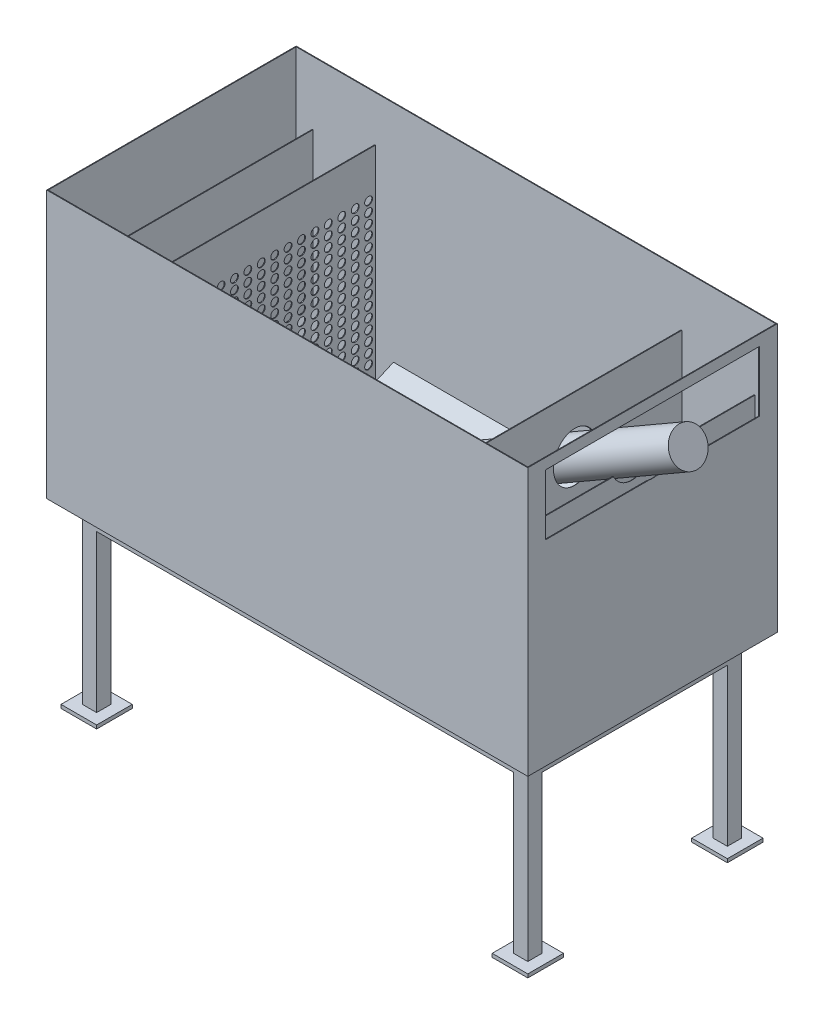
from build123d import *

# Parameters (mm, degrees)
MASTER_FOOTPRINT_W                  = 1350
MASTER_FOOTPRINT_H                  = 700
BATH_BASE_PLATE_DEPTH               = 750
BATH_SHELL_2MM_T                    = -2
SKETCH_1_R                          = 50
INLET_D100_OPENING_DEPTH            = 10
INLET_IMPACT_BAFFLE_START           = 125
SKETCH_2_W                          = 540
SKETCH_2_H                          = 430
INLET_IMPACT_BAFFLE_DEPTH           = 2
DISTRIBUTOR_D22_START               = 250
SKETCH_3_W                          = 640
SKETCH_3_H                          = 648
SKETCH_3_R                          = 11
DISTRIBUTOR_D22_DEPTH               = 2
OUTLET_SUBMERGED_BAFFLE_START       = 1130
SKETCH_4_W                          = 600
SKETCH_4_H                          = 330
OUTLET_SUBMERGED_BAFFLE_DEPTH       = 2
OVERFLOW_WEIR_Z550_START            = 1290
SKETCH_5_W                          = 690
SKETCH_5_H                          = 548
OVERFLOW_WEIR_Z550_DEPTH            = 2
OUTLET_WEIR_SLOT_W600_START         = 1345
SKETCH_6_W                          = 600
SKETCH_6_H                          = 170
OUTLET_WEIR_SLOT_W600_DEPTH         = 10
SLOPED_SEDIMENT_FLOOR_START         = 275
SLOPED_SEDIMENT_FLOOR_DEPTH         = 825
SKETCH_8_W                          = 40
SKETCH_8_H                          = 40
FRAME_LEGS_40X40_H500_DEPTH         = 500
FRAME_LONGITUDINAL_RAILS_START      = -20
SKETCH_9_W                          = 1250
SKETCH_9_H                          = 40
FRAME_LONGITUDINAL_RAILS_DEPTH      = 40
FRAME_TRANSVERSE_RAILS_START        = -20
SKETCH_10_W                         = 40
SKETCH_10_H                         = 520
FRAME_TRANSVERSE_RAILS_DEPTH        = 40
FRAME_FOOT_PADS_100X100_START       = -500
SKETCH_11_W                         = 100
SKETCH_11_H                         = 100
FRAME_FOOT_PADS_100X100_DEPTH       = 10
SEALED_SCREW_PASSAGE_D120_PROFILE_R = 60
SCREW_OUTER_ENVELOPE_D100_PROFILE_R = 50


with BuildPart() as part:
    # MASTER_FOOTPRINT → BATH_BASE_PLATE (new body)
    with BuildSketch(Plane(origin=(0, 0, 0), x_dir=(1, 0, 0), z_dir=(0, 1, 0))):
        with Locations((675, 350)):
            Rectangle(MASTER_FOOTPRINT_W, MASTER_FOOTPRINT_H)
    extrude(amount=BATH_BASE_PLATE_DEPTH)

    # BATH_SHELL_2MM
    bath_shell_2mm_openings = [part.faces().sort_by_distance(p)[0] for p in [
        (675, 750, -350),
    ]]
    offset(amount=BATH_SHELL_2MM_T, openings=bath_shell_2mm_openings, kind=Kind.INTERSECTION)

    # Эскиз1 → INLET_D100_OPENING (cut)
    with BuildSketch(Plane(origin=(0, 0, 0), x_dir=(0, 0, -1), z_dir=(1, 0, 0))):
        with Locations((350, 420)):
            Circle(SKETCH_1_R)
    extrude(amount=INLET_D100_OPENING_DEPTH, mode=Mode.SUBTRACT)

    # Эскиз6 → OUTLET_WEIR_SLOT_W600 (cut)
    with BuildSketch(Plane(origin=(0, 0, 0), x_dir=(0, 0, -1), z_dir=(1, 0, 0)).offset(OUTLET_WEIR_SLOT_W600_START)):
        with Locations((350, 635)):
            Rectangle(SKETCH_6_W, SKETCH_6_H)
    extrude(amount=OUTLET_WEIR_SLOT_W600_DEPTH, mode=Mode.SUBTRACT)

    # Эскиз7 → SLOPED_SEDIMENT_FLOOR (add)
    with BuildSketch(Plane(origin=(0, 0, 0), x_dir=(0, 0, -1), z_dir=(1, 0, 0)).offset(SLOPED_SEDIMENT_FLOOR_START)):
        Polygon((2, -1), (2, 120), (280, -1), align=None)
        Polygon((698, -1), (698, 120), (420, -1), align=None)
    extrude(amount=SLOPED_SEDIMENT_FLOOR_DEPTH)

    # Эскиз8 → FRAME_LEGS_40X40_H500 (add)
    with BuildSketch(Plane(origin=(0, 0, 0), x_dir=(1, 0, 0), z_dir=(0, 1, 0))):
        with Locations((70, 70)):
            Rectangle(SKETCH_8_W, SKETCH_8_H)
        with Locations((70, 630)):
            Rectangle(SKETCH_8_W, SKETCH_8_H)
        with Locations((1280, 70)):
            Rectangle(SKETCH_8_W, SKETCH_8_H)
        with Locations((1280, 630)):
            Rectangle(SKETCH_8_W, SKETCH_8_H)
    extrude(amount=-FRAME_LEGS_40X40_H500_DEPTH)

    # Эскиз9 → FRAME_LONGITUDINAL_RAILS (add)
    with BuildSketch(Plane(origin=(0, 0, 0), x_dir=(1, 0, 0), z_dir=(0, 1, 0)).offset(FRAME_LONGITUDINAL_RAILS_START)):
        with Locations((675, 70)):
            Rectangle(SKETCH_9_W, SKETCH_9_H)
        with Locations((675, 630)):
            Rectangle(SKETCH_9_W, SKETCH_9_H)
    extrude(amount=-FRAME_LONGITUDINAL_RAILS_DEPTH)

    # Эскиз10 → FRAME_TRANSVERSE_RAILS (add)
    with BuildSketch(Plane(origin=(0, 0, 0), x_dir=(1, 0, 0), z_dir=(0, 1, 0)).offset(FRAME_TRANSVERSE_RAILS_START)):
        with Locations((70, 350)):
            Rectangle(SKETCH_10_W, SKETCH_10_H)
        with Locations((1280, 350)):
            Rectangle(SKETCH_10_W, SKETCH_10_H)
    extrude(amount=-FRAME_TRANSVERSE_RAILS_DEPTH)

    # Эскиз11 → FRAME_FOOT_PADS_100X100 (add)
    with BuildSketch(Plane(origin=(0, 0, 0), x_dir=(1, 0, 0), z_dir=(0, 1, 0)).offset(FRAME_FOOT_PADS_100X100_START)):
        with Locations((70, 70)):
            Rectangle(SKETCH_11_W, SKETCH_11_H)
        with Locations((70, 630)):
            Rectangle(SKETCH_11_W, SKETCH_11_H)
        with Locations((1280, 70)):
            Rectangle(SKETCH_11_W, SKETCH_11_H)
        with Locations((1280, 630)):
            Rectangle(SKETCH_11_W, SKETCH_11_H)
    extrude(amount=-FRAME_FOOT_PADS_100X100_DEPTH)


with BuildPart() as body_2:
    # Эскиз2 → INLET_IMPACT_BAFFLE (new body)
    with BuildSketch(Plane(origin=(0, 0, 0), x_dir=(0, 0, -1), z_dir=(1, 0, 0)).offset(INLET_IMPACT_BAFFLE_START)):
        with Locations((350, 435)):
            Rectangle(SKETCH_2_W, SKETCH_2_H)
    extrude(amount=INLET_IMPACT_BAFFLE_DEPTH)


with BuildPart() as body_3:
    # Эскиз3 → DISTRIBUTOR_D22 (new body)
    with BuildSketch(Plane(origin=(0, 0, 0), x_dir=(0, 0, -1), z_dir=(1, 0, 0)).offset(DISTRIBUTOR_D22_START)):
        with Locations((350, 326)):
            Rectangle(SKETCH_3_W, SKETCH_3_H)
        with Locations((48.823529412, 125)):
            Circle(SKETCH_3_R, mode=Mode.SUBTRACT)
        with Locations((48.823529412, 153.5)):
            Circle(SKETCH_3_R, mode=Mode.SUBTRACT)
        with Locations((48.823529412, 182)):
            Circle(SKETCH_3_R, mode=Mode.SUBTRACT)
        with Locations((48.823529412, 210.5)):
            Circle(SKETCH_3_R, mode=Mode.SUBTRACT)
        with Locations((48.823529412, 239)):
            Circle(SKETCH_3_R, mode=Mode.SUBTRACT)
        with Locations((48.823529412, 267.5)):
            Circle(SKETCH_3_R, mode=Mode.SUBTRACT)
        with Locations((48.823529412, 296)):
            Circle(SKETCH_3_R, mode=Mode.SUBTRACT)
        with Locations((48.823529412, 324.5)):
            Circle(SKETCH_3_R, mode=Mode.SUBTRACT)
        with Locations((48.823529412, 353)):
            Circle(SKETCH_3_R, mode=Mode.SUBTRACT)
        with Locations((48.823529412, 381.5)):
            Circle(SKETCH_3_R, mode=Mode.SUBTRACT)
        with Locations((48.823529412, 410)):
            Circle(SKETCH_3_R, mode=Mode.SUBTRACT)
        with Locations((48.823529412, 438.5)):
            Circle(SKETCH_3_R, mode=Mode.SUBTRACT)
        with Locations((48.823529412, 467)):
            Circle(SKETCH_3_R, mode=Mode.SUBTRACT)
        with Locations((48.823529412, 495.5)):
            Circle(SKETCH_3_R, mode=Mode.SUBTRACT)
        with Locations((48.823529412, 524)):
            Circle(SKETCH_3_R, mode=Mode.SUBTRACT)
        with Locations((86.470588235, 125)):
            Circle(SKETCH_3_R, mode=Mode.SUBTRACT)
        with Locations((86.470588235, 153.5)):
            Circle(SKETCH_3_R, mode=Mode.SUBTRACT)
        with Locations((86.470588235, 182)):
            Circle(SKETCH_3_R, mode=Mode.SUBTRACT)
        with Locations((86.470588235, 210.5)):
            Circle(SKETCH_3_R, mode=Mode.SUBTRACT)
        with Locations((86.470588235, 239)):
            Circle(SKETCH_3_R, mode=Mode.SUBTRACT)
        with Locations((86.470588235, 267.5)):
            Circle(SKETCH_3_R, mode=Mode.SUBTRACT)
        with Locations((86.470588235, 296)):
            Circle(SKETCH_3_R, mode=Mode.SUBTRACT)
        with Locations((86.470588235, 324.5)):
            Circle(SKETCH_3_R, mode=Mode.SUBTRACT)
        with Locations((86.470588235, 353)):
            Circle(SKETCH_3_R, mode=Mode.SUBTRACT)
        with Locations((86.470588235, 381.5)):
            Circle(SKETCH_3_R, mode=Mode.SUBTRACT)
        with Locations((86.470588235, 410)):
            Circle(SKETCH_3_R, mode=Mode.SUBTRACT)
        with Locations((86.470588235, 438.5)):
            Circle(SKETCH_3_R, mode=Mode.SUBTRACT)
        with Locations((86.470588235, 467)):
            Circle(SKETCH_3_R, mode=Mode.SUBTRACT)
        with Locations((86.470588235, 495.5)):
            Circle(SKETCH_3_R, mode=Mode.SUBTRACT)
        with Locations((86.470588235, 524)):
            Circle(SKETCH_3_R, mode=Mode.SUBTRACT)
        with Locations((124.117647059, 125)):
            Circle(SKETCH_3_R, mode=Mode.SUBTRACT)
        with Locations((124.117647059, 153.5)):
            Circle(SKETCH_3_R, mode=Mode.SUBTRACT)
        with Locations((124.117647059, 182)):
            Circle(SKETCH_3_R, mode=Mode.SUBTRACT)
        with Locations((124.117647059, 210.5)):
            Circle(SKETCH_3_R, mode=Mode.SUBTRACT)
        with Locations((124.117647059, 239)):
            Circle(SKETCH_3_R, mode=Mode.SUBTRACT)
        with Locations((124.117647059, 267.5)):
            Circle(SKETCH_3_R, mode=Mode.SUBTRACT)
        with Locations((124.117647059, 296)):
            Circle(SKETCH_3_R, mode=Mode.SUBTRACT)
        with Locations((124.117647059, 324.5)):
            Circle(SKETCH_3_R, mode=Mode.SUBTRACT)
        with Locations((124.117647059, 353)):
            Circle(SKETCH_3_R, mode=Mode.SUBTRACT)
        with Locations((124.117647059, 381.5)):
            Circle(SKETCH_3_R, mode=Mode.SUBTRACT)
        with Locations((124.117647059, 410)):
            Circle(SKETCH_3_R, mode=Mode.SUBTRACT)
        with Locations((124.117647059, 438.5)):
            Circle(SKETCH_3_R, mode=Mode.SUBTRACT)
        with Locations((124.117647059, 467)):
            Circle(SKETCH_3_R, mode=Mode.SUBTRACT)
        with Locations((124.117647059, 495.5)):
            Circle(SKETCH_3_R, mode=Mode.SUBTRACT)
        with Locations((124.117647059, 524)):
            Circle(SKETCH_3_R, mode=Mode.SUBTRACT)
        with Locations((161.764705882, 125)):
            Circle(SKETCH_3_R, mode=Mode.SUBTRACT)
        with Locations((161.764705882, 153.5)):
            Circle(SKETCH_3_R, mode=Mode.SUBTRACT)
        with Locations((161.764705882, 182)):
            Circle(SKETCH_3_R, mode=Mode.SUBTRACT)
        with Locations((161.764705882, 210.5)):
            Circle(SKETCH_3_R, mode=Mode.SUBTRACT)
        with Locations((161.764705882, 239)):
            Circle(SKETCH_3_R, mode=Mode.SUBTRACT)
        with Locations((161.764705882, 267.5)):
            Circle(SKETCH_3_R, mode=Mode.SUBTRACT)
        with Locations((161.764705882, 296)):
            Circle(SKETCH_3_R, mode=Mode.SUBTRACT)
        with Locations((161.764705882, 324.5)):
            Circle(SKETCH_3_R, mode=Mode.SUBTRACT)
        with Locations((161.764705882, 353)):
            Circle(SKETCH_3_R, mode=Mode.SUBTRACT)
        with Locations((161.764705882, 381.5)):
            Circle(SKETCH_3_R, mode=Mode.SUBTRACT)
        with Locations((161.764705882, 410)):
            Circle(SKETCH_3_R, mode=Mode.SUBTRACT)
        with Locations((161.764705882, 438.5)):
            Circle(SKETCH_3_R, mode=Mode.SUBTRACT)
        with Locations((161.764705882, 467)):
            Circle(SKETCH_3_R, mode=Mode.SUBTRACT)
        with Locations((161.764705882, 495.5)):
            Circle(SKETCH_3_R, mode=Mode.SUBTRACT)
        with Locations((161.764705882, 524)):
            Circle(SKETCH_3_R, mode=Mode.SUBTRACT)
        with Locations((199.411764706, 125)):
            Circle(SKETCH_3_R, mode=Mode.SUBTRACT)
        with Locations((199.411764706, 153.5)):
            Circle(SKETCH_3_R, mode=Mode.SUBTRACT)
        with Locations((199.411764706, 182)):
            Circle(SKETCH_3_R, mode=Mode.SUBTRACT)
        with Locations((199.411764706, 210.5)):
            Circle(SKETCH_3_R, mode=Mode.SUBTRACT)
        with Locations((199.411764706, 239)):
            Circle(SKETCH_3_R, mode=Mode.SUBTRACT)
        with Locations((199.411764706, 267.5)):
            Circle(SKETCH_3_R, mode=Mode.SUBTRACT)
        with Locations((199.411764706, 296)):
            Circle(SKETCH_3_R, mode=Mode.SUBTRACT)
        with Locations((199.411764706, 324.5)):
            Circle(SKETCH_3_R, mode=Mode.SUBTRACT)
        with Locations((199.411764706, 353)):
            Circle(SKETCH_3_R, mode=Mode.SUBTRACT)
        with Locations((199.411764706, 381.5)):
            Circle(SKETCH_3_R, mode=Mode.SUBTRACT)
        with Locations((199.411764706, 410)):
            Circle(SKETCH_3_R, mode=Mode.SUBTRACT)
        with Locations((199.411764706, 438.5)):
            Circle(SKETCH_3_R, mode=Mode.SUBTRACT)
        with Locations((199.411764706, 467)):
            Circle(SKETCH_3_R, mode=Mode.SUBTRACT)
        with Locations((199.411764706, 495.5)):
            Circle(SKETCH_3_R, mode=Mode.SUBTRACT)
        with Locations((199.411764706, 524)):
            Circle(SKETCH_3_R, mode=Mode.SUBTRACT)
        with Locations((237.058823529, 125)):
            Circle(SKETCH_3_R, mode=Mode.SUBTRACT)
        with Locations((237.058823529, 153.5)):
            Circle(SKETCH_3_R, mode=Mode.SUBTRACT)
        with Locations((237.058823529, 182)):
            Circle(SKETCH_3_R, mode=Mode.SUBTRACT)
        with Locations((237.058823529, 210.5)):
            Circle(SKETCH_3_R, mode=Mode.SUBTRACT)
        with Locations((237.058823529, 239)):
            Circle(SKETCH_3_R, mode=Mode.SUBTRACT)
        with Locations((237.058823529, 267.5)):
            Circle(SKETCH_3_R, mode=Mode.SUBTRACT)
        with Locations((237.058823529, 296)):
            Circle(SKETCH_3_R, mode=Mode.SUBTRACT)
        with Locations((237.058823529, 324.5)):
            Circle(SKETCH_3_R, mode=Mode.SUBTRACT)
        with Locations((237.058823529, 353)):
            Circle(SKETCH_3_R, mode=Mode.SUBTRACT)
        with Locations((237.058823529, 381.5)):
            Circle(SKETCH_3_R, mode=Mode.SUBTRACT)
        with Locations((237.058823529, 410)):
            Circle(SKETCH_3_R, mode=Mode.SUBTRACT)
        with Locations((237.058823529, 438.5)):
            Circle(SKETCH_3_R, mode=Mode.SUBTRACT)
        with Locations((237.058823529, 467)):
            Circle(SKETCH_3_R, mode=Mode.SUBTRACT)
        with Locations((237.058823529, 495.5)):
            Circle(SKETCH_3_R, mode=Mode.SUBTRACT)
        with Locations((237.058823529, 524)):
            Circle(SKETCH_3_R, mode=Mode.SUBTRACT)
        with Locations((274.705882353, 125)):
            Circle(SKETCH_3_R, mode=Mode.SUBTRACT)
        with Locations((274.705882353, 153.5)):
            Circle(SKETCH_3_R, mode=Mode.SUBTRACT)
        with Locations((274.705882353, 182)):
            Circle(SKETCH_3_R, mode=Mode.SUBTRACT)
        with Locations((274.705882353, 210.5)):
            Circle(SKETCH_3_R, mode=Mode.SUBTRACT)
        with Locations((274.705882353, 239)):
            Circle(SKETCH_3_R, mode=Mode.SUBTRACT)
        with Locations((274.705882353, 267.5)):
            Circle(SKETCH_3_R, mode=Mode.SUBTRACT)
        with Locations((274.705882353, 296)):
            Circle(SKETCH_3_R, mode=Mode.SUBTRACT)
        with Locations((274.705882353, 324.5)):
            Circle(SKETCH_3_R, mode=Mode.SUBTRACT)
        with Locations((274.705882353, 353)):
            Circle(SKETCH_3_R, mode=Mode.SUBTRACT)
        with Locations((274.705882353, 381.5)):
            Circle(SKETCH_3_R, mode=Mode.SUBTRACT)
        with Locations((274.705882353, 410)):
            Circle(SKETCH_3_R, mode=Mode.SUBTRACT)
        with Locations((274.705882353, 438.5)):
            Circle(SKETCH_3_R, mode=Mode.SUBTRACT)
        with Locations((274.705882353, 467)):
            Circle(SKETCH_3_R, mode=Mode.SUBTRACT)
        with Locations((274.705882353, 495.5)):
            Circle(SKETCH_3_R, mode=Mode.SUBTRACT)
        with Locations((274.705882353, 524)):
            Circle(SKETCH_3_R, mode=Mode.SUBTRACT)
        with Locations((312.352941176, 125)):
            Circle(SKETCH_3_R, mode=Mode.SUBTRACT)
        with Locations((312.352941176, 153.5)):
            Circle(SKETCH_3_R, mode=Mode.SUBTRACT)
        with Locations((312.352941176, 182)):
            Circle(SKETCH_3_R, mode=Mode.SUBTRACT)
        with Locations((312.352941176, 210.5)):
            Circle(SKETCH_3_R, mode=Mode.SUBTRACT)
        with Locations((312.352941176, 239)):
            Circle(SKETCH_3_R, mode=Mode.SUBTRACT)
        with Locations((312.352941176, 267.5)):
            Circle(SKETCH_3_R, mode=Mode.SUBTRACT)
        with Locations((312.352941176, 296)):
            Circle(SKETCH_3_R, mode=Mode.SUBTRACT)
        with Locations((312.352941176, 324.5)):
            Circle(SKETCH_3_R, mode=Mode.SUBTRACT)
        with Locations((312.352941176, 353)):
            Circle(SKETCH_3_R, mode=Mode.SUBTRACT)
        with Locations((312.352941176, 381.5)):
            Circle(SKETCH_3_R, mode=Mode.SUBTRACT)
        with Locations((312.352941176, 410)):
            Circle(SKETCH_3_R, mode=Mode.SUBTRACT)
        with Locations((312.352941176, 438.5)):
            Circle(SKETCH_3_R, mode=Mode.SUBTRACT)
        with Locations((312.352941176, 467)):
            Circle(SKETCH_3_R, mode=Mode.SUBTRACT)
        with Locations((312.352941176, 495.5)):
            Circle(SKETCH_3_R, mode=Mode.SUBTRACT)
        with Locations((312.352941176, 524)):
            Circle(SKETCH_3_R, mode=Mode.SUBTRACT)
        with Locations((350, 125)):
            Circle(SKETCH_3_R, mode=Mode.SUBTRACT)
        with Locations((350, 153.5)):
            Circle(SKETCH_3_R, mode=Mode.SUBTRACT)
        with Locations((350, 182)):
            Circle(SKETCH_3_R, mode=Mode.SUBTRACT)
        with Locations((350, 210.5)):
            Circle(SKETCH_3_R, mode=Mode.SUBTRACT)
        with Locations((350, 239)):
            Circle(SKETCH_3_R, mode=Mode.SUBTRACT)
        with Locations((350, 267.5)):
            Circle(SKETCH_3_R, mode=Mode.SUBTRACT)
        with Locations((350, 296)):
            Circle(SKETCH_3_R, mode=Mode.SUBTRACT)
        with Locations((350, 324.5)):
            Circle(SKETCH_3_R, mode=Mode.SUBTRACT)
        with Locations((350, 353)):
            Circle(SKETCH_3_R, mode=Mode.SUBTRACT)
        with Locations((350, 381.5)):
            Circle(SKETCH_3_R, mode=Mode.SUBTRACT)
        with Locations((350, 410)):
            Circle(SKETCH_3_R, mode=Mode.SUBTRACT)
        with Locations((350, 438.5)):
            Circle(SKETCH_3_R, mode=Mode.SUBTRACT)
        with Locations((350, 467)):
            Circle(SKETCH_3_R, mode=Mode.SUBTRACT)
        with Locations((350, 495.5)):
            Circle(SKETCH_3_R, mode=Mode.SUBTRACT)
        with Locations((350, 524)):
            Circle(SKETCH_3_R, mode=Mode.SUBTRACT)
        with Locations((387.647058824, 125)):
            Circle(SKETCH_3_R, mode=Mode.SUBTRACT)
        with Locations((387.647058824, 153.5)):
            Circle(SKETCH_3_R, mode=Mode.SUBTRACT)
        with Locations((387.647058824, 182)):
            Circle(SKETCH_3_R, mode=Mode.SUBTRACT)
        with Locations((387.647058824, 210.5)):
            Circle(SKETCH_3_R, mode=Mode.SUBTRACT)
        with Locations((387.647058824, 239)):
            Circle(SKETCH_3_R, mode=Mode.SUBTRACT)
        with Locations((387.647058824, 267.5)):
            Circle(SKETCH_3_R, mode=Mode.SUBTRACT)
        with Locations((387.647058824, 296)):
            Circle(SKETCH_3_R, mode=Mode.SUBTRACT)
        with Locations((387.647058824, 324.5)):
            Circle(SKETCH_3_R, mode=Mode.SUBTRACT)
        with Locations((387.647058824, 353)):
            Circle(SKETCH_3_R, mode=Mode.SUBTRACT)
        with Locations((387.647058824, 381.5)):
            Circle(SKETCH_3_R, mode=Mode.SUBTRACT)
        with Locations((387.647058824, 410)):
            Circle(SKETCH_3_R, mode=Mode.SUBTRACT)
        with Locations((387.647058824, 438.5)):
            Circle(SKETCH_3_R, mode=Mode.SUBTRACT)
        with Locations((387.647058824, 467)):
            Circle(SKETCH_3_R, mode=Mode.SUBTRACT)
        with Locations((387.647058824, 495.5)):
            Circle(SKETCH_3_R, mode=Mode.SUBTRACT)
        with Locations((387.647058824, 524)):
            Circle(SKETCH_3_R, mode=Mode.SUBTRACT)
        with Locations((425.294117647, 125)):
            Circle(SKETCH_3_R, mode=Mode.SUBTRACT)
        with Locations((425.294117647, 153.5)):
            Circle(SKETCH_3_R, mode=Mode.SUBTRACT)
        with Locations((425.294117647, 182)):
            Circle(SKETCH_3_R, mode=Mode.SUBTRACT)
        with Locations((425.294117647, 210.5)):
            Circle(SKETCH_3_R, mode=Mode.SUBTRACT)
        with Locations((425.294117647, 239)):
            Circle(SKETCH_3_R, mode=Mode.SUBTRACT)
        with Locations((425.294117647, 267.5)):
            Circle(SKETCH_3_R, mode=Mode.SUBTRACT)
        with Locations((425.294117647, 296)):
            Circle(SKETCH_3_R, mode=Mode.SUBTRACT)
        with Locations((425.294117647, 324.5)):
            Circle(SKETCH_3_R, mode=Mode.SUBTRACT)
        with Locations((425.294117647, 353)):
            Circle(SKETCH_3_R, mode=Mode.SUBTRACT)
        with Locations((425.294117647, 381.5)):
            Circle(SKETCH_3_R, mode=Mode.SUBTRACT)
        with Locations((425.294117647, 410)):
            Circle(SKETCH_3_R, mode=Mode.SUBTRACT)
        with Locations((425.294117647, 438.5)):
            Circle(SKETCH_3_R, mode=Mode.SUBTRACT)
        with Locations((425.294117647, 467)):
            Circle(SKETCH_3_R, mode=Mode.SUBTRACT)
        with Locations((425.294117647, 495.5)):
            Circle(SKETCH_3_R, mode=Mode.SUBTRACT)
        with Locations((425.294117647, 524)):
            Circle(SKETCH_3_R, mode=Mode.SUBTRACT)
        with Locations((462.941176471, 125)):
            Circle(SKETCH_3_R, mode=Mode.SUBTRACT)
        with Locations((462.941176471, 153.5)):
            Circle(SKETCH_3_R, mode=Mode.SUBTRACT)
        with Locations((462.941176471, 182)):
            Circle(SKETCH_3_R, mode=Mode.SUBTRACT)
        with Locations((462.941176471, 210.5)):
            Circle(SKETCH_3_R, mode=Mode.SUBTRACT)
        with Locations((462.941176471, 239)):
            Circle(SKETCH_3_R, mode=Mode.SUBTRACT)
        with Locations((462.941176471, 267.5)):
            Circle(SKETCH_3_R, mode=Mode.SUBTRACT)
        with Locations((462.941176471, 296)):
            Circle(SKETCH_3_R, mode=Mode.SUBTRACT)
        with Locations((462.941176471, 324.5)):
            Circle(SKETCH_3_R, mode=Mode.SUBTRACT)
        with Locations((462.941176471, 353)):
            Circle(SKETCH_3_R, mode=Mode.SUBTRACT)
        with Locations((462.941176471, 381.5)):
            Circle(SKETCH_3_R, mode=Mode.SUBTRACT)
        with Locations((462.941176471, 410)):
            Circle(SKETCH_3_R, mode=Mode.SUBTRACT)
        with Locations((462.941176471, 438.5)):
            Circle(SKETCH_3_R, mode=Mode.SUBTRACT)
        with Locations((462.941176471, 467)):
            Circle(SKETCH_3_R, mode=Mode.SUBTRACT)
        with Locations((462.941176471, 495.5)):
            Circle(SKETCH_3_R, mode=Mode.SUBTRACT)
        with Locations((462.941176471, 524)):
            Circle(SKETCH_3_R, mode=Mode.SUBTRACT)
        with Locations((500.588235294, 125)):
            Circle(SKETCH_3_R, mode=Mode.SUBTRACT)
        with Locations((500.588235294, 153.5)):
            Circle(SKETCH_3_R, mode=Mode.SUBTRACT)
        with Locations((500.588235294, 182)):
            Circle(SKETCH_3_R, mode=Mode.SUBTRACT)
        with Locations((500.588235294, 210.5)):
            Circle(SKETCH_3_R, mode=Mode.SUBTRACT)
        with Locations((500.588235294, 239)):
            Circle(SKETCH_3_R, mode=Mode.SUBTRACT)
        with Locations((500.588235294, 267.5)):
            Circle(SKETCH_3_R, mode=Mode.SUBTRACT)
        with Locations((500.588235294, 296)):
            Circle(SKETCH_3_R, mode=Mode.SUBTRACT)
        with Locations((500.588235294, 324.5)):
            Circle(SKETCH_3_R, mode=Mode.SUBTRACT)
        with Locations((500.588235294, 353)):
            Circle(SKETCH_3_R, mode=Mode.SUBTRACT)
        with Locations((500.588235294, 381.5)):
            Circle(SKETCH_3_R, mode=Mode.SUBTRACT)
        with Locations((500.588235294, 410)):
            Circle(SKETCH_3_R, mode=Mode.SUBTRACT)
        with Locations((500.588235294, 438.5)):
            Circle(SKETCH_3_R, mode=Mode.SUBTRACT)
        with Locations((500.588235294, 467)):
            Circle(SKETCH_3_R, mode=Mode.SUBTRACT)
        with Locations((500.588235294, 495.5)):
            Circle(SKETCH_3_R, mode=Mode.SUBTRACT)
        with Locations((500.588235294, 524)):
            Circle(SKETCH_3_R, mode=Mode.SUBTRACT)
        with Locations((538.235294118, 125)):
            Circle(SKETCH_3_R, mode=Mode.SUBTRACT)
        with Locations((538.235294118, 153.5)):
            Circle(SKETCH_3_R, mode=Mode.SUBTRACT)
        with Locations((538.235294118, 182)):
            Circle(SKETCH_3_R, mode=Mode.SUBTRACT)
        with Locations((538.235294118, 210.5)):
            Circle(SKETCH_3_R, mode=Mode.SUBTRACT)
        with Locations((538.235294118, 239)):
            Circle(SKETCH_3_R, mode=Mode.SUBTRACT)
        with Locations((538.235294118, 267.5)):
            Circle(SKETCH_3_R, mode=Mode.SUBTRACT)
        with Locations((538.235294118, 296)):
            Circle(SKETCH_3_R, mode=Mode.SUBTRACT)
        with Locations((538.235294118, 324.5)):
            Circle(SKETCH_3_R, mode=Mode.SUBTRACT)
        with Locations((538.235294118, 353)):
            Circle(SKETCH_3_R, mode=Mode.SUBTRACT)
        with Locations((538.235294118, 381.5)):
            Circle(SKETCH_3_R, mode=Mode.SUBTRACT)
        with Locations((538.235294118, 410)):
            Circle(SKETCH_3_R, mode=Mode.SUBTRACT)
        with Locations((538.235294118, 438.5)):
            Circle(SKETCH_3_R, mode=Mode.SUBTRACT)
        with Locations((538.235294118, 467)):
            Circle(SKETCH_3_R, mode=Mode.SUBTRACT)
        with Locations((538.235294118, 495.5)):
            Circle(SKETCH_3_R, mode=Mode.SUBTRACT)
        with Locations((538.235294118, 524)):
            Circle(SKETCH_3_R, mode=Mode.SUBTRACT)
        with Locations((575.882352941, 125)):
            Circle(SKETCH_3_R, mode=Mode.SUBTRACT)
        with Locations((575.882352941, 153.5)):
            Circle(SKETCH_3_R, mode=Mode.SUBTRACT)
        with Locations((575.882352941, 182)):
            Circle(SKETCH_3_R, mode=Mode.SUBTRACT)
        with Locations((575.882352941, 210.5)):
            Circle(SKETCH_3_R, mode=Mode.SUBTRACT)
        with Locations((575.882352941, 239)):
            Circle(SKETCH_3_R, mode=Mode.SUBTRACT)
        with Locations((575.882352941, 267.5)):
            Circle(SKETCH_3_R, mode=Mode.SUBTRACT)
        with Locations((575.882352941, 296)):
            Circle(SKETCH_3_R, mode=Mode.SUBTRACT)
        with Locations((575.882352941, 324.5)):
            Circle(SKETCH_3_R, mode=Mode.SUBTRACT)
        with Locations((575.882352941, 353)):
            Circle(SKETCH_3_R, mode=Mode.SUBTRACT)
        with Locations((575.882352941, 381.5)):
            Circle(SKETCH_3_R, mode=Mode.SUBTRACT)
        with Locations((575.882352941, 410)):
            Circle(SKETCH_3_R, mode=Mode.SUBTRACT)
        with Locations((575.882352941, 438.5)):
            Circle(SKETCH_3_R, mode=Mode.SUBTRACT)
        with Locations((575.882352941, 467)):
            Circle(SKETCH_3_R, mode=Mode.SUBTRACT)
        with Locations((575.882352941, 495.5)):
            Circle(SKETCH_3_R, mode=Mode.SUBTRACT)
        with Locations((575.882352941, 524)):
            Circle(SKETCH_3_R, mode=Mode.SUBTRACT)
        with Locations((613.529411765, 125)):
            Circle(SKETCH_3_R, mode=Mode.SUBTRACT)
        with Locations((613.529411765, 153.5)):
            Circle(SKETCH_3_R, mode=Mode.SUBTRACT)
        with Locations((613.529411765, 182)):
            Circle(SKETCH_3_R, mode=Mode.SUBTRACT)
        with Locations((613.529411765, 210.5)):
            Circle(SKETCH_3_R, mode=Mode.SUBTRACT)
        with Locations((613.529411765, 239)):
            Circle(SKETCH_3_R, mode=Mode.SUBTRACT)
        with Locations((613.529411765, 267.5)):
            Circle(SKETCH_3_R, mode=Mode.SUBTRACT)
        with Locations((613.529411765, 296)):
            Circle(SKETCH_3_R, mode=Mode.SUBTRACT)
        with Locations((613.529411765, 324.5)):
            Circle(SKETCH_3_R, mode=Mode.SUBTRACT)
        with Locations((613.529411765, 353)):
            Circle(SKETCH_3_R, mode=Mode.SUBTRACT)
        with Locations((613.529411765, 381.5)):
            Circle(SKETCH_3_R, mode=Mode.SUBTRACT)
        with Locations((613.529411765, 410)):
            Circle(SKETCH_3_R, mode=Mode.SUBTRACT)
        with Locations((613.529411765, 438.5)):
            Circle(SKETCH_3_R, mode=Mode.SUBTRACT)
        with Locations((613.529411765, 467)):
            Circle(SKETCH_3_R, mode=Mode.SUBTRACT)
        with Locations((613.529411765, 495.5)):
            Circle(SKETCH_3_R, mode=Mode.SUBTRACT)
        with Locations((613.529411765, 524)):
            Circle(SKETCH_3_R, mode=Mode.SUBTRACT)
        with Locations((651.176470588, 125)):
            Circle(SKETCH_3_R, mode=Mode.SUBTRACT)
        with Locations((651.176470588, 153.5)):
            Circle(SKETCH_3_R, mode=Mode.SUBTRACT)
        with Locations((651.176470588, 182)):
            Circle(SKETCH_3_R, mode=Mode.SUBTRACT)
        with Locations((651.176470588, 210.5)):
            Circle(SKETCH_3_R, mode=Mode.SUBTRACT)
        with Locations((651.176470588, 239)):
            Circle(SKETCH_3_R, mode=Mode.SUBTRACT)
        with Locations((651.176470588, 267.5)):
            Circle(SKETCH_3_R, mode=Mode.SUBTRACT)
        with Locations((651.176470588, 296)):
            Circle(SKETCH_3_R, mode=Mode.SUBTRACT)
        with Locations((651.176470588, 324.5)):
            Circle(SKETCH_3_R, mode=Mode.SUBTRACT)
        with Locations((651.176470588, 353)):
            Circle(SKETCH_3_R, mode=Mode.SUBTRACT)
        with Locations((651.176470588, 381.5)):
            Circle(SKETCH_3_R, mode=Mode.SUBTRACT)
        with Locations((651.176470588, 410)):
            Circle(SKETCH_3_R, mode=Mode.SUBTRACT)
        with Locations((651.176470588, 438.5)):
            Circle(SKETCH_3_R, mode=Mode.SUBTRACT)
        with Locations((651.176470588, 467)):
            Circle(SKETCH_3_R, mode=Mode.SUBTRACT)
        with Locations((651.176470588, 495.5)):
            Circle(SKETCH_3_R, mode=Mode.SUBTRACT)
        with Locations((651.176470588, 524)):
            Circle(SKETCH_3_R, mode=Mode.SUBTRACT)
    extrude(amount=DISTRIBUTOR_D22_DEPTH)


with BuildPart() as body_4:
    # Эскиз4 → OUTLET_SUBMERGED_BAFFLE (new body)
    with BuildSketch(Plane(origin=(0, 0, 0), x_dir=(0, 0, -1), z_dir=(1, 0, 0)).offset(OUTLET_SUBMERGED_BAFFLE_START)):
        with Locations((350, 485)):
            Rectangle(SKETCH_4_W, SKETCH_4_H)
    extrude(amount=OUTLET_SUBMERGED_BAFFLE_DEPTH)


with BuildPart() as body_5:
    # Эскиз5 → OVERFLOW_WEIR_Z550 (new body)
    with BuildSketch(Plane(origin=(0, 0, 0), x_dir=(0, 0, -1), z_dir=(1, 0, 0)).offset(OVERFLOW_WEIR_Z550_START)):
        with Locations((350, 276)):
            Rectangle(SKETCH_5_W, SKETCH_5_H)
    extrude(amount=OVERFLOW_WEIR_Z550_DEPTH)


with BuildPart() as sealed_screw_passage_d120_tool:
    # SEALED_SCREW_PASSAGE_D120: sweep along a curve in space
    with BuildLine() as sealed_screw_passage_d120_path:
        Line((400, 70, -350), (1450, 676.217782649, -350))
    # SEALED_SCREW_PASSAGE_D120 profile (on start of the path) → SEALED_SCREW_PASSAGE_D120 (sweep)
    with BuildSketch(Plane(origin=(400, 70, -350), x_dir=(-0.5, 0.8660254037844387, 0), z_dir=(0.8660254037844387, 0.5, 0))):
        Circle(SEALED_SCREW_PASSAGE_D120_PROFILE_R)
    sweep(path=sealed_screw_passage_d120_path.line)


with BuildPart() as part_1:
    add(part.part)

    # SEALED_SCREW_PASSAGE_D120: cut by sealed_screw_passage_d120_tool
    add(sealed_screw_passage_d120_tool.part, mode=Mode.SUBTRACT)


with BuildPart() as body_4_1:
    add(body_4.part)

    # SEALED_SCREW_PASSAGE_D120: cut by sealed_screw_passage_d120_tool
    add(sealed_screw_passage_d120_tool.part, mode=Mode.SUBTRACT)


with BuildPart() as body_5_1:
    add(body_5.part)

    # SEALED_SCREW_PASSAGE_D120: cut by sealed_screw_passage_d120_tool
    add(sealed_screw_passage_d120_tool.part, mode=Mode.SUBTRACT)


with BuildPart() as body_6:
    # SCREW_OUTER_ENVELOPE_D100: sweep along a curve in space
    with BuildLine() as screw_outer_envelope_d100_path:
        Line((400, 70, -350), (1450, 676.217782649, -350))
    # SCREW_OUTER_ENVELOPE_D100 profile (on start of the path) → SCREW_OUTER_ENVELOPE_D100 (sweep)
    with BuildSketch(Plane(origin=(400, 70, -350), x_dir=(-0.5, 0.8660254037844387, 0), z_dir=(0.8660254037844387, 0.5, 0))):
        Circle(SCREW_OUTER_ENVELOPE_D100_PROFILE_R)
    sweep(path=screw_outer_envelope_d100_path.line)


solid = Compound([body_2.part, body_3.part, part_1.part, body_4_1.part, body_5_1.part, body_6.part])
